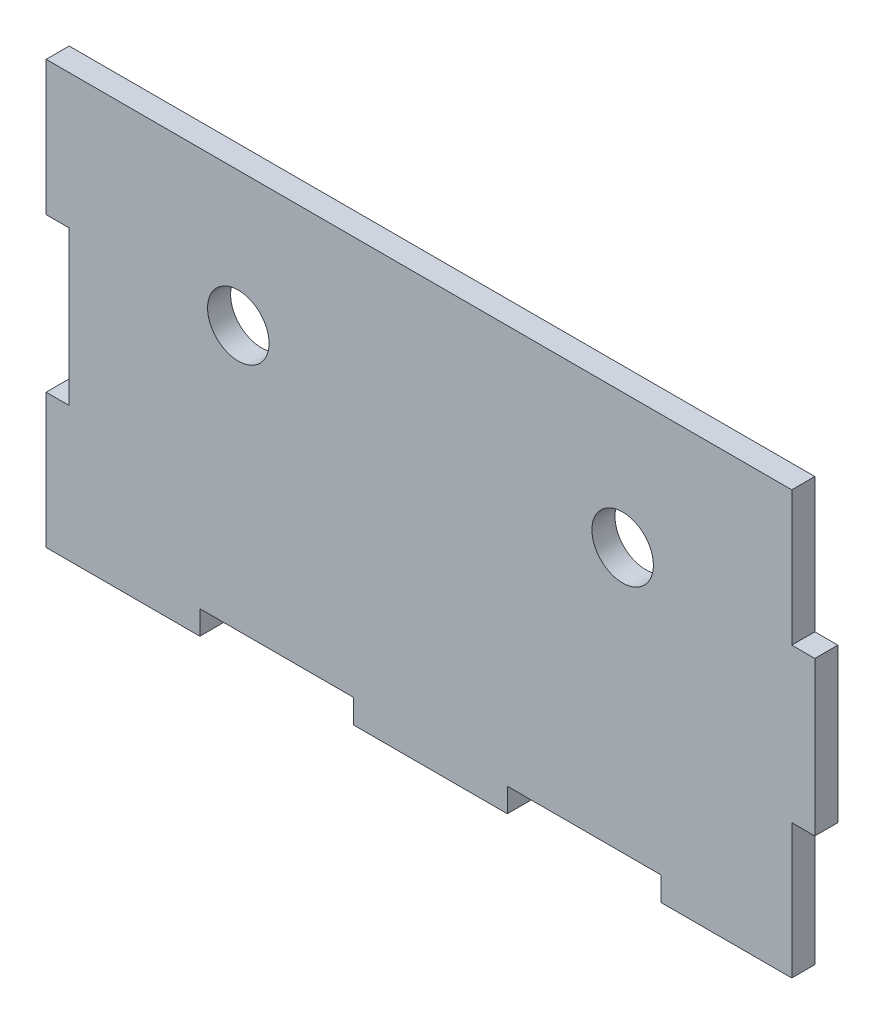
from build123d import *

# Parameters (mm, degrees)
SKETCH1_R           = 4
BOSS_EXTRUDE1_DEPTH = 3


with BuildPart() as part:
    # Sketch1 → Boss-Extrude1 (new body)
    with BuildSketch(Plane.XY):
        Polygon((-50, -10), (-50, -27.5), (-30, -27.5), (-30, -24.393503037), (-10, -24.393503037), (-10, -27.5), (10, -27.5), (10, -24.393503037), (30, -24.393503037), (30, -27.5), (47, -27.5), (47, -10), (50, -10), (50, 10), (47, 10), (47, 27.5), (-50, 27.5), (-50, 10), (-47, 10), (-47, -10), align=None)
        with Locations((-25, 10)):
            Circle(SKETCH1_R, mode=Mode.SUBTRACT)
        with Locations((25, 10)):
            Circle(SKETCH1_R, mode=Mode.SUBTRACT)
    extrude(amount=BOSS_EXTRUDE1_DEPTH)


solid = part.part
